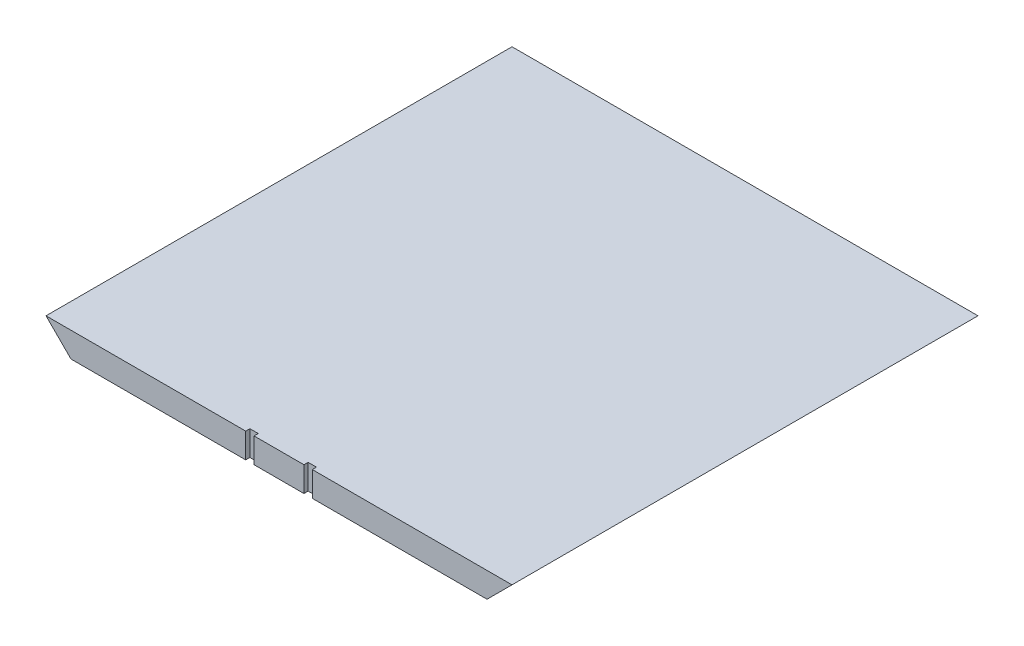
from build123d import *

# Parameters (mm, degrees)
SKETCH1_W           = 355.6
SKETCH1_H           = 355.6
BOSS_EXTRUDE1_DEPTH = 9.525
CHAMFER1_SIZE       = 19.05
SKETCH2_W           = 6.35
SKETCH2_H           = 19.05
CUT_EXTRUDE1_DEPTH  = 3.175


with BuildPart() as part:
    # Sketch1 → Boss-Extrude1 (new, symmetric)
    with BuildSketch(Plane(origin=(0, 0, 0), x_dir=(1, 0, 0), z_dir=(0, 1, 0))):
        Rectangle(SKETCH1_W, SKETCH1_H)
    extrude(amount=BOSS_EXTRUDE1_DEPTH, both=True)

    # Chamfer1
    chamfer1_edges = [part.edges().sort_by_distance(p)[0] for p in [
        (177.8, -9.525, 0),
        (-177.8, -9.525, 0),
    ]]
    chamfer(chamfer1_edges, length=CHAMFER1_SIZE - 0.0001)  # a hair under: the kernel refuses the full size

    # Sketch2 → Cut-Extrude1 (cut)
    with BuildSketch(Plane.XY.offset(177.8)):
        with Locations((22.225, 0)):
            Rectangle(SKETCH2_W, SKETCH2_H)
        with Locations((-22.225, 0)):
            Rectangle(SKETCH2_W, SKETCH2_H)
    extrude(amount=-CUT_EXTRUDE1_DEPTH, mode=Mode.SUBTRACT)


solid = part.part
